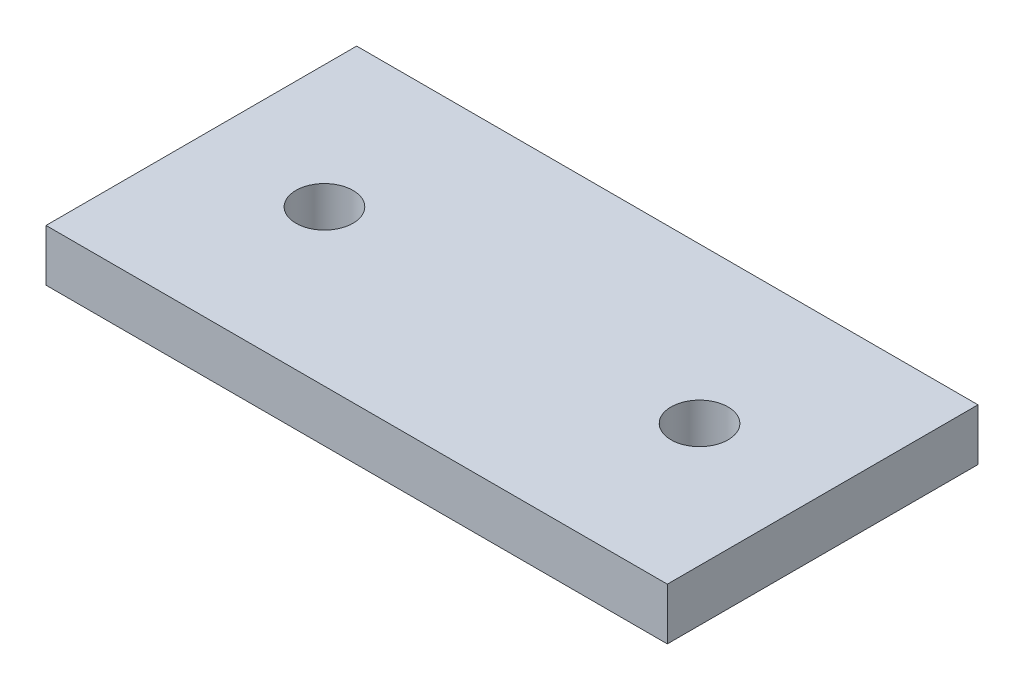
from build123d import *

# Parameters (mm, degrees)
SKETCH1_W            = 76.2
SKETCH1_H            = 38.1
BOSS_EXTRUDE1_DEPTH  = 6.35
M6_CLEARANCE_HOLE1_D = 7


with BuildPart() as part:
    # Sketch1 → Boss-Extrude1 (new body)
    with BuildSketch(Plane(origin=(0, 0, 0), x_dir=(1, 0, 0), z_dir=(0, 1, 0))):
        Rectangle(SKETCH1_W, SKETCH1_H)
    extrude(amount=BOSS_EXTRUDE1_DEPTH)

    # M6 Clearance Hole1 (through all)
    with Locations(Plane(origin=(0, 6.35, 0), x_dir=(1, 0, 0), z_dir=(0, 1, 0))):
        with Locations((-22.999999974, 0), (22.999999974, 0)):
            Hole(M6_CLEARANCE_HOLE1_D / 2)


solid = part.part
